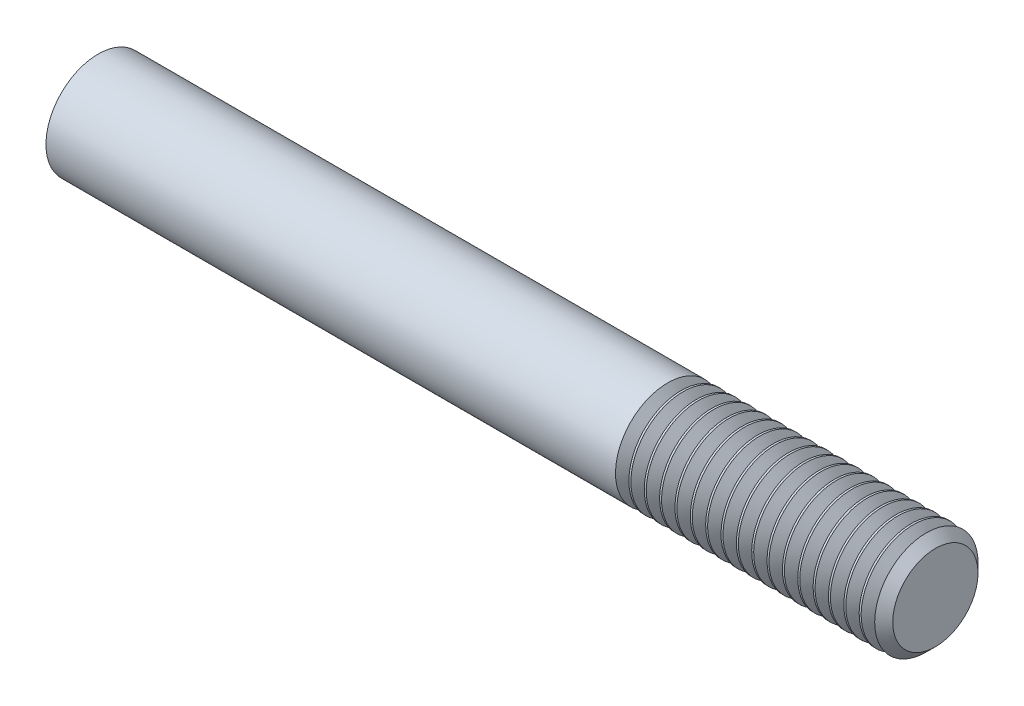
from build123d import *

# Parameters (mm, degrees)
BASEHEAD_DEPTH        = 0.254
SKETCH4_W             = 0.381
SKETCH4_H             = 26.382348419
THDSCHPAT_COUNT       = 17
THDSCHPAT_PITCH       = 1.867647059
CORTAR_EXTRUIR1_DEPTH = 53.34


with BuildPart() as part:
    # Sketch1 → BaseHead (new body)
    with BuildSketch(Plane(origin=(0, 0, 0), x_dir=(0, 0, -1), z_dir=(1, 0, 0))):
        Polygon((6.35, 3.666174209), (6.35, -3.666174209), (0, -7.332348419), (-6.35, -3.666174209), (-6.35, 3.666174209), (0, 7.332348419), align=None)
    extrude(amount=BASEHEAD_DEPTH)

    # BodySke → BaseBody (revolve)
    with BuildSketch(Plane.XY):
        Polygon((0, 0), (101.854, 0), (101.854, 5.18668), (100.69068, 6.35), (0, 6.35), align=None)
    revolve(axis=Axis((0, 0, 0), (1, 0, 0)))

    # Sketch3 → HeadChamfer (revolve, cut)
    with BuildSketch(Plane.XY):
        Polygon((0, 6.35), (4.233333333, 13.682348419), (4.233333333, 20.032348419), (-12.7, 20.032348419), (-12.7, 6.35), align=None)
    revolve(axis=Axis((0, 0, 0), (1, 0, 0)), mode=Mode.SUBTRACT)

    # Sketch4 → BearingFace (revolve, cut)
    with BuildSketch(Plane.XY):
        with Locations((0.0635, 19.54117421)):
            Rectangle(SKETCH4_W, SKETCH4_H)
    revolve(axis=Axis((0, 0, 0), (1, 0, 0)), mode=Mode.SUBTRACT)

    # ThdSchSke → ThreadSchematic (revolve, cut)
    with BuildSketch(Plane.XY):
        Polygon((70.104, -5.18668), (69.289434567, -6.35), (69.289434567, -7.9375), (70.918565433, -7.9375), (70.918565433, -6.35), align=None)
    threadschematic = revolve(axis=Axis((-3.175, 0, 0), (1, 0, 0)), mode=Mode.SUBTRACT)

    # ThdSchPat: ThreadSchematic ×17
    with Locations(*[(i * THDSCHPAT_PITCH, 0, 0) for i in range(1, THDSCHPAT_COUNT)]):
        add(threadschematic, mode=Mode.SUBTRACT)

    # Croquis1 → Cortar-Extruir1 (cut)
    with BuildSketch(Plane.ZY):
        with BuildLine():
            Line((-1.905, 2.54), (1.905, 2.54))
            ThreePointArc((1.905, 2.54), (0, -3.175), (-1.905, 2.54))
        make_face()
    extrude(amount=-CORTAR_EXTRUIR1_DEPTH, mode=Mode.SUBTRACT)


solid = part.part
